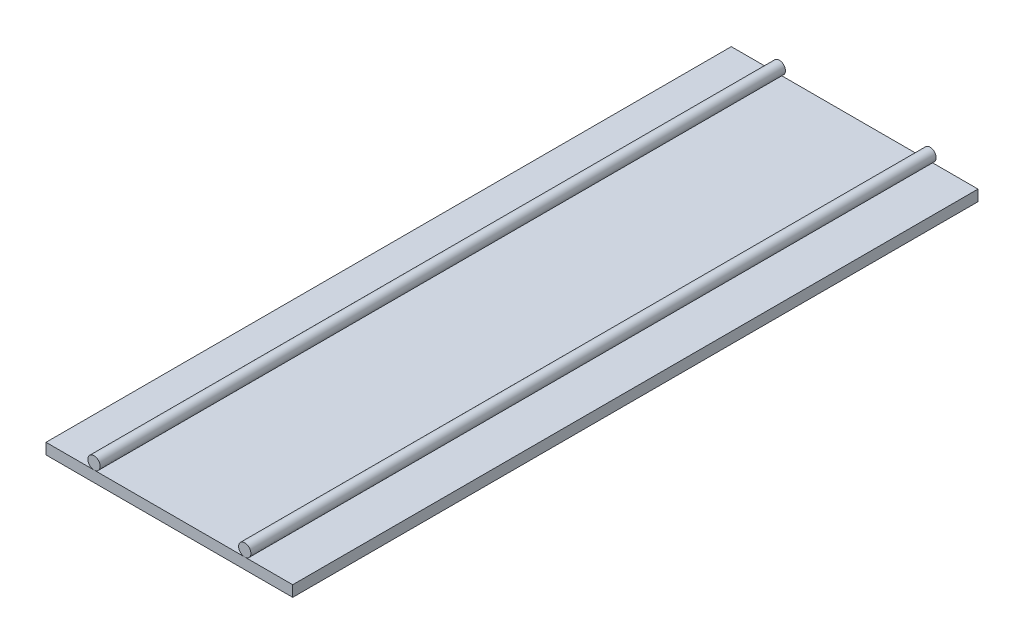
from build123d import *

# Parameters (mm, degrees)
SZKIC1_R                      = 22.5
DODANIE_WYCI_GNI_CIE1_DEPTH   = 1250
DODANIE_WYCI_GNI_CIE1_2_DEPTH = 1250
SZKIC2_W                      = 900
SZKIC2_H                      = 40
DODANIE_WYCI_GNI_CIE2_DEPTH   = 1250


with BuildPart() as part:
    # Szkic1 → Dodanie-wyciągnięcie1 (new, symmetric)
    with BuildSketch(Plane.XY):
        with Locations((-275, 0)):
            Circle(SZKIC1_R)
    extrude(amount=DODANIE_WYCI_GNI_CIE1_DEPTH, both=True)


with BuildPart() as body_2:
    # Szkic1 → Dodanie-wyci_gni_cie1 2 (new, symmetric)
    with BuildSketch(Plane.XY):
        with Locations((275, 0)):
            Circle(SZKIC1_R)
    extrude(amount=DODANIE_WYCI_GNI_CIE1_2_DEPTH, both=True)


with BuildPart() as body_3:
    # Szkic2 → Dodanie-wyciągnięcie2 (new, symmetric)
    with BuildSketch(Plane.XY):
        with Locations((0, -42.5)):
            Rectangle(SZKIC2_W, SZKIC2_H)
    extrude(amount=DODANIE_WYCI_GNI_CIE2_DEPTH, both=True)


solid = Compound([part.part, body_2.part, body_3.part])
